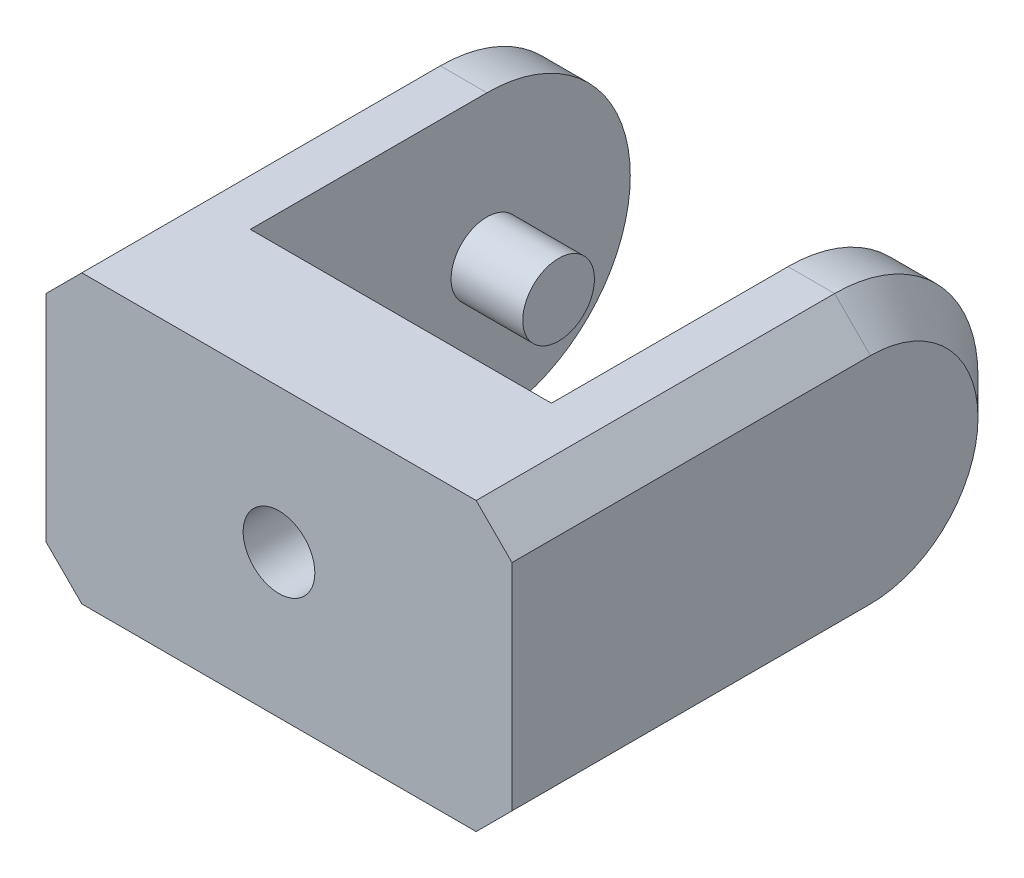
from build123d import *

# Parameters (mm, degrees)
SKETCH1_W           = 65
SKETCH1_H           = 40
BOSS_EXTRUDE1_DEPTH = 17
SKETCH2_W           = 11.5
SKETCH2_H           = 40
BOSS_EXTRUDE2_DEPTH = 53
FILLET1_R           = 20
CHAMFER1_SIZE       = 5
SKETCH3_R           = 5
CUT_EXTRUDE1_DEPTH  = 10
SKETCH4_R           = 5
BOSS_EXTRUDE3_DEPTH = 10


with BuildPart() as part:
    # Sketch1 → Boss-Extrude1 (new body)
    with BuildSketch(Plane.XY):
        with Locations((32.5, 20)):
            Rectangle(SKETCH1_W, SKETCH1_H)
    extrude(amount=BOSS_EXTRUDE1_DEPTH)

    # Sketch2 → Boss-Extrude2 (add)
    with BuildSketch(Plane(origin=(0, 0, 0), x_dir=(-1, 0, 0), z_dir=(0, 0, -1))):
        with Locations((-5.75, 20)):
            Rectangle(SKETCH2_W, SKETCH2_H)
        with Locations((-59.25, 20)):
            Rectangle(SKETCH2_W, SKETCH2_H)
    extrude(amount=BOSS_EXTRUDE2_DEPTH)

    # Fillet1
    fillet1_edges = [part.edges().sort_by_distance(p)[0] for p in [
        (59.25, 40, -53),
        (5.75, 40, -53),
        (59.25, 0, -53),
        (5.75, 0, -53),
    ]]
    fillet(fillet1_edges, radius=FILLET1_R - 0.0001)  # a hair under: the kernel refuses the full size

    # Chamfer1
    chamfer1_edges = [part.edges().sort_by_distance(p)[0] for p in [
        (65, 5.857835087, -47.142164913),
        (65, 34.142164913, -47.142164913),
        (0, 5.857835087, -47.142164913),
        (0, 34.142164913, -47.142164913),
        (0, 0, -8.00005),
        (65, 0, -8.00005),
        (65, 40, -8.00005),
        (0, 40, -8.00005),
    ]]
    chamfer(chamfer1_edges, length=CHAMFER1_SIZE)

    # Sketch3 → Cut-Extrude1 (cut)
    with BuildSketch(Plane.XY.offset(17)):
        with Locations((32.5, 20)):
            Circle(SKETCH3_R)
    extrude(amount=-CUT_EXTRUDE1_DEPTH, mode=Mode.SUBTRACT)

    # Sketch4 → Boss-Extrude3 (add)
    with BuildSketch(Plane(origin=(11.5, 0, 0), x_dir=(0, 0, -1), z_dir=(1, 0, 0))):
        with Locations(Location((33, 20, 0), (0, 0, 270))):
            Circle(SKETCH4_R)
    extrude(amount=BOSS_EXTRUDE3_DEPTH)


solid = part.part
